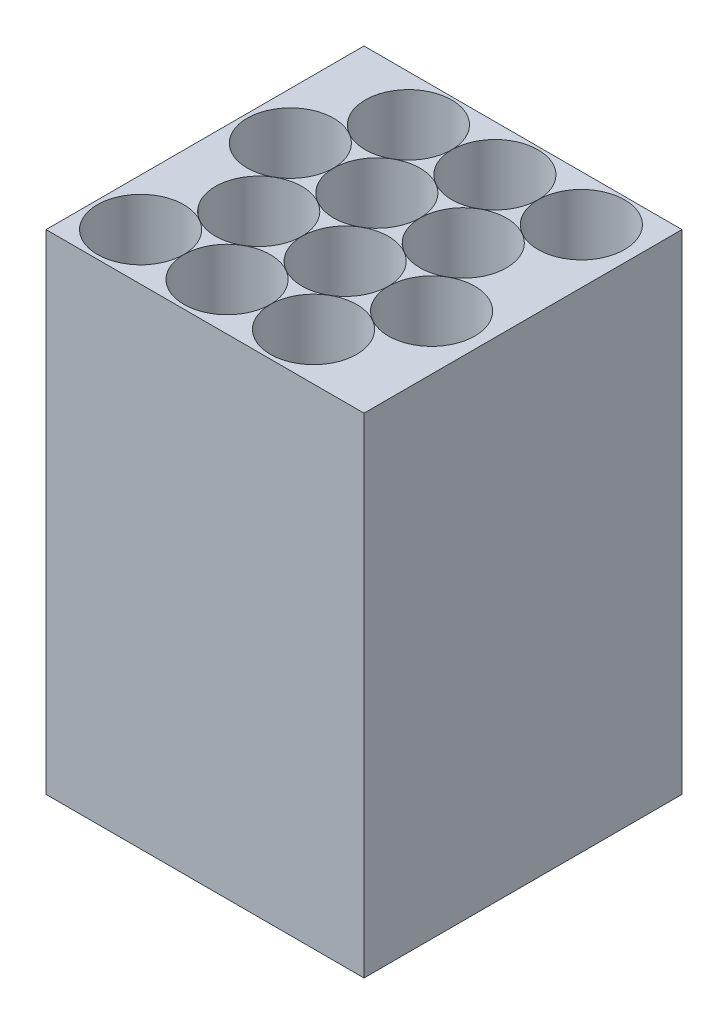
from build123d import *

# Parameters (mm, degrees)
SKETCH1_W               = 97.5
SKETCH1_H               = 97.5
BOSS_EXTRUDE1_DEPTH     = 150
SKETCH5_R               = 13.25
CUT_EXTRUDE5_DEPTH      = 166.085205273
FILL_PATTERN1_OUTLINE_R = 13.25
FILL_PATTERN1_DEPTH     = 150


# Read off the part's stored shape, not the designer's step: Fill Pattern1
with BuildPart() as part:
    # Sketch1 → Boss-Extrude1 (new body)
    with BuildSketch(Plane(origin=(0, 0, 0), x_dir=(1, 0, 0), z_dir=(0, 1, 0))):
        Rectangle(SKETCH1_W, SKETCH1_H)
    extrude(amount=BOSS_EXTRUDE1_DEPTH)

    # Sketch5 → Cut-Extrude5 (cut, through all)
    with BuildSketch(Plane(origin=(0, 150, 0), x_dir=(1, 0, 0), z_dir=(0, 1, 0))):
        with Locations(Location((-34.25, -34.25, 0), (0, 0, 270))):
            Circle(SKETCH5_R)
    extrude(amount=-CUT_EXTRUDE5_DEPTH, mode=Mode.SUBTRACT)

    # Fill Pattern1 outline → Fill Pattern1 (cut)
    with BuildSketch(Plane(origin=(0, 0, 0), x_dir=(1, 0, 0), z_dir=(0, 1, 0))):
        with Locations((32.025, 34.625000363)):
            Circle(FILL_PATTERN1_OUTLINE_R)
        with Locations((32.025, -11.291666546)):
            Circle(FILL_PATTERN1_OUTLINE_R)
        with Locations((18.77, 11.666666909)):
            Circle(FILL_PATTERN1_OUTLINE_R)
        with Locations((5.515, 34.625000363)):
            Circle(FILL_PATTERN1_OUTLINE_R)
        with Locations((18.77, -34.25)):
            Circle(FILL_PATTERN1_OUTLINE_R)
        with Locations((5.515, -11.291666546)):
            Circle(FILL_PATTERN1_OUTLINE_R)
        with Locations((-7.74, 11.666666909)):
            Circle(FILL_PATTERN1_OUTLINE_R)
        with Locations((-20.995, 34.625000363)):
            Circle(FILL_PATTERN1_OUTLINE_R)
        with Locations((-7.74, -34.25)):
            Circle(FILL_PATTERN1_OUTLINE_R)
        with Locations((-20.995, -11.291666546)):
            Circle(FILL_PATTERN1_OUTLINE_R)
        with Locations((-34.25, 11.666666909)):
            Circle(FILL_PATTERN1_OUTLINE_R)
    extrude(amount=FILL_PATTERN1_DEPTH, mode=Mode.SUBTRACT)


solid = part.part
